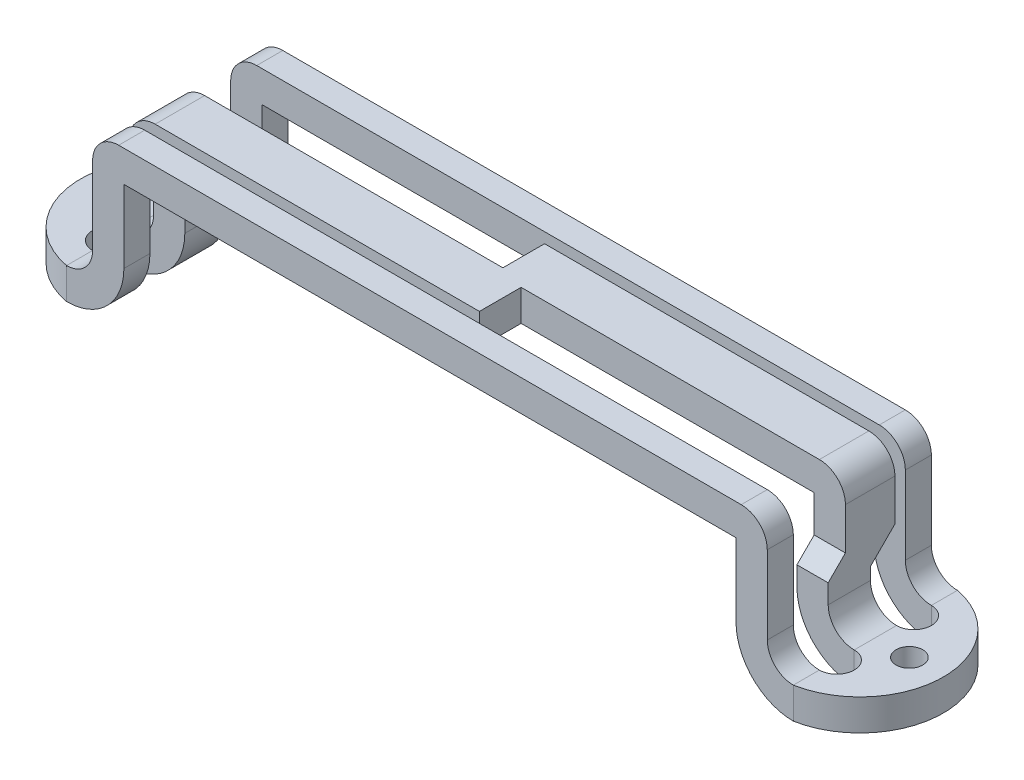
from build123d import *

# Parameters (mm, degrees)
EXTRUDE_THIN1_DEPTH    = 16.002
CUT_EXTRUDE1_START     = -15.748
CUT_EXTRUDE1_OUTLINE_R = 1.3
CUT_EXTRUDE1_DEPTH     = 15.748
BOSS_EXTRUDE2_DEPTH    = 1.68
BOSS_EXTRUDE3_START    = 1.68
BOSS_EXTRUDE3_DEPTH    = 1.68
CUT_EXTRUDE2_START     = -2.384
CUT_EXTRUDE2_DEPTH     = 2.384
CUT_EXTRUDE3_DEPTH     = 2.384
CHAMFER1_SIZE          = 1.7
CHAMFER2_SIZE          = 2.38


# Read off the part's stored shape, not the designer's step: Cut-Extrude1
with BuildPart() as part:
    # Sketch1 → Extrude-Thin1 (new body)
    with BuildSketch(Plane.XY):
        with BuildLine():
            Line((-42.06875, -12.7), (-35.433, -12.7))
            ThreePointArc((-35.433, -12.7), (-33.636948776, -11.956051224), (-32.893, -10.16))
            Line((-32.893, -10.16), (-32.893, -2.54))
            ThreePointArc((-32.893, -2.54), (-32.149051224, -0.743948776), (-30.353, 0))
            Line((-30.353, 0), (30.353, 0))
            ThreePointArc((30.353, 0), (32.149051224, -0.743948776), (32.893, -2.54))
            Line((32.893, -2.54), (32.893, -10.16))
            ThreePointArc((32.893, -10.16), (33.636948776, -11.956051224), (35.433, -12.7))
            Line((35.433, -12.7), (42.06875, -12.7))
            Line((42.06875, -12.7), (42.06875, -15.748))
            Line((42.06875, -15.748), (35.433, -15.748))
            ThreePointArc((35.433, -15.748), (31.481687307, -14.111312693), (29.845, -10.16))
            Line((29.845, -10.16), (29.845, -3.048))
            Line((29.845, -3.048), (-29.845, -3.048))
            Line((-29.845, -3.048), (-29.845, -10.16))
            ThreePointArc((-29.845, -10.16), (-31.481687307, -14.111312693), (-35.433, -15.748))
            Line((-35.433, -15.748), (-42.06875, -15.748))
            Line((-42.06875, -15.748), (-42.06875, -12.7))
        make_face()
    extrude(amount=-EXTRUDE_THIN1_DEPTH)

    # Cut-Extrude1 outline → Cut-Extrude1 (cut)
    with BuildSketch(Plane(origin=(0, 0, 0), x_dir=(1, 0, 0), z_dir=(0, 1, 0)).offset(CUT_EXTRUDE1_START)):
        with BuildLine():
            Line((35.433, 13.462), (-35.433, 13.462))
            ThreePointArc((-35.433, 13.462), (-37.133, 11.762), (-35.433, 10.062))
            Line((-35.433, 10.062), (-32.893, 10.062))
            Line((-32.893, 10.062), (-32.893, 8.382))
            Line((-32.893, 8.382), (-1.27, 8.382))
            Line((-1.27, 8.382), (-1.27, 12.446))
            Line((-1.27, 12.446), (32.893, 12.446))
            Line((32.893, 12.446), (32.893, 10.062))
            Line((32.893, 10.062), (35.433, 10.062))
            ThreePointArc((35.433, 10.062), (37.133, 11.762), (35.433, 13.462))
        make_face()
        with BuildLine():
            Line((32.893, 5.94), (32.893, 7.62))
            Line((32.893, 7.62), (1.27, 7.62))
            Line((1.27, 7.62), (1.27, 3.556))
            Line((1.27, 3.556), (-32.893, 3.556))
            Line((-32.893, 3.556), (-32.893, 5.94))
            Line((-32.893, 5.94), (-35.433, 5.94))
            ThreePointArc((-35.433, 5.94), (-37.133, 4.24), (-35.433, 2.54))
            Line((-35.433, 2.54), (35.433, 2.54))
            ThreePointArc((35.433, 2.54), (37.133, 4.24), (35.433, 5.94))
            Line((35.433, 5.94), (32.893, 5.94))
        make_face()
        with BuildLine():
            Line((42.06875, 16.002), (35.433, 16.002))
            ThreePointArc((35.433, 16.002), (40.193949205, 13.198335352), (42.06875, 8.001))
            Line((42.06875, 8.001), (42.06875, 16.002))
        make_face()
        with BuildLine():
            Line((42.06875, 0), (42.06875, 8.001))
            ThreePointArc((42.06875, 8.001), (40.193949205, 2.803664648), (35.433, 0))
            Line((35.433, 0), (42.06875, 0))
        make_face()
        with BuildLine():
            ThreePointArc((-42.06875, 8.001), (-40.193949205, 13.198335352), (-35.433, 16.002))
            Line((-35.433, 16.002), (-42.06875, 16.002))
            Line((-42.06875, 16.002), (-42.06875, 8.001))
        make_face()
        with BuildLine():
            ThreePointArc((-35.433, 0), (-40.193949205, 2.803664648), (-42.06875, 8.001))
            Line((-42.06875, 8.001), (-42.06875, 0))
            Line((-42.06875, 0), (-35.433, 0))
        make_face()
        with Locations((38.750875, 8.001)):
            Circle(CUT_EXTRUDE1_OUTLINE_R)
        with Locations((-38.750875, 8.001)):
            Circle(CUT_EXTRUDE1_OUTLINE_R)
    extrude(amount=CUT_EXTRUDE1_DEPTH, mode=Mode.SUBTRACT)

    # Sketch6 → Boss-Extrude2 (add)
    with BuildSketch(Plane(origin=(0, 0, -8.382), x_dir=(-1, 0, 0), z_dir=(0, 0, -1))):
        with BuildLine():
            Line((32.893, -10.16), (32.893, -6.604))
            Line((32.893, -6.604), (29.845, -6.604))
            Line((29.845, -6.604), (29.845, -10.16))
            ThreePointArc((29.845, -10.16), (30.667537588, -13.078237824), (32.893, -15.137363157))
            Line((32.893, -15.137363157), (32.893, -10.16))
        make_face()
    extrude(amount=BOSS_EXTRUDE2_DEPTH)

    # Sketch7 → Boss-Extrude3 (add)
    with BuildSketch(Plane.XY.offset(-7.62).offset(BOSS_EXTRUDE3_START)):
        with BuildLine():
            Line((32.893, -10.16), (32.893, -6.6))
            Line((32.893, -6.6), (29.845, -6.604))
            Line((29.845, -6.604), (29.845, -10.16))
            ThreePointArc((29.845, -10.16), (30.667537588, -13.078237824), (32.893, -15.137363157))
            Line((32.893, -15.137363157), (32.893, -10.16))
        make_face()
    extrude(amount=-BOSS_EXTRUDE3_DEPTH)

    # Sketch8 → Cut-Extrude2 (cut)
    with BuildSketch(Plane(origin=(0, 0, -12.446), x_dir=(-1, 0, 0), z_dir=(0, 0, -1)).offset(CUT_EXTRUDE2_START)):
        with BuildLine():
            Line((-32.893, -15.137363157), (-32.893, -6.6))
            Line((-32.893, -6.6), (-29.845, -6.604))
            Line((-29.845, -6.604), (-29.845, -10.16))
            ThreePointArc((-29.845, -10.16), (-30.667537588, -13.078237824), (-32.893, -15.137363157))
        make_face()
    extrude(amount=CUT_EXTRUDE2_DEPTH, mode=Mode.SUBTRACT)

    # Sketch9 → Cut-Extrude3 (cut)
    with BuildSketch(Plane.XY.offset(-3.556)):
        with BuildLine():
            Line((-32.893, -15.137363157), (-32.893, -6.604))
            Line((-32.893, -6.604), (-29.845, -6.604))
            Line((-29.845, -6.604), (-29.845, -10.16))
            ThreePointArc((-29.845, -10.16), (-30.667537588, -13.078237824), (-32.893, -15.137363157))
        make_face()
    extrude(amount=-CUT_EXTRUDE3_DEPTH, mode=Mode.SUBTRACT)

    # Chamfer1
    # the kernel refuses this chamfer: 1.7 mm, written as the material it adds along each edge
    # the kernel refuses this chamfer: 1.7 mm, written as the material it takes off along each edge
    with BuildSketch(Plane(origin=(-37.26486108, -6.604, -10.062), x_dir=(0, -0.9996219169112968, -0.02749587661058687), z_dir=(1, 0, 0))) as chamfer1_2_piece_1_section:
        Polygon((CHAMFER1_SIZE * 0.999621916911, -CHAMFER1_SIZE * 0.0274958766106), (-CHAMFER1_SIZE * 0.0274958766106, -CHAMFER1_SIZE * 0.999621916911), (0, 0), align=None)
    chamfer1_2_piece_1 = extrude(amount=11.791722159, mode=Mode.PRIVATE)
    chamfer1_2_piece_1 = split(chamfer1_2_piece_1, bisect_by=Plane(origin=(-31.369, -7.170744186, -8.382), z_dir=(0, 0, -1)), keep=Keep.TOP, mode=Mode.PRIVATE)
    add(chamfer1_2_piece_1, mode=Mode.SUBTRACT)
    with BuildSketch(Plane(origin=(37.264857315, -6.594262654, -5.94), x_dir=(0.00131183865632537, -0.9996210561251475, 0.02749587661058631), z_dir=(-0.999999138888279, -0.0013123348279305267, 0))) as chamfer1_2_piece_2_section:
        Polygon((CHAMFER1_SIZE * 0.999621916911, -CHAMFER1_SIZE * 0.0274958766106), (-CHAMFER1_SIZE * 0.0274958766106, -CHAMFER1_SIZE * 0.999621916911), (0, 0), align=None)
    chamfer1_2_piece_2 = extrude(amount=11.791724784, mode=Mode.PRIVATE)
    chamfer1_2_piece_2 = split(chamfer1_2_piece_2, bisect_by=Plane(origin=(31.369, -7.168744674, -7.62), z_dir=(0, 0, 1)), keep=Keep.TOP, mode=Mode.PRIVATE)
    add(chamfer1_2_piece_2, mode=Mode.SUBTRACT)

    # Chamfer2
    chamfer2_edges = [part.edges().sort_by_distance(p)[0] for p in [
        (31.369, -6.602, -10.062),
        (-31.369, -6.604, -5.94),
    ]]
    chamfer(chamfer2_edges, length=CHAMFER2_SIZE)


solid = part.part
